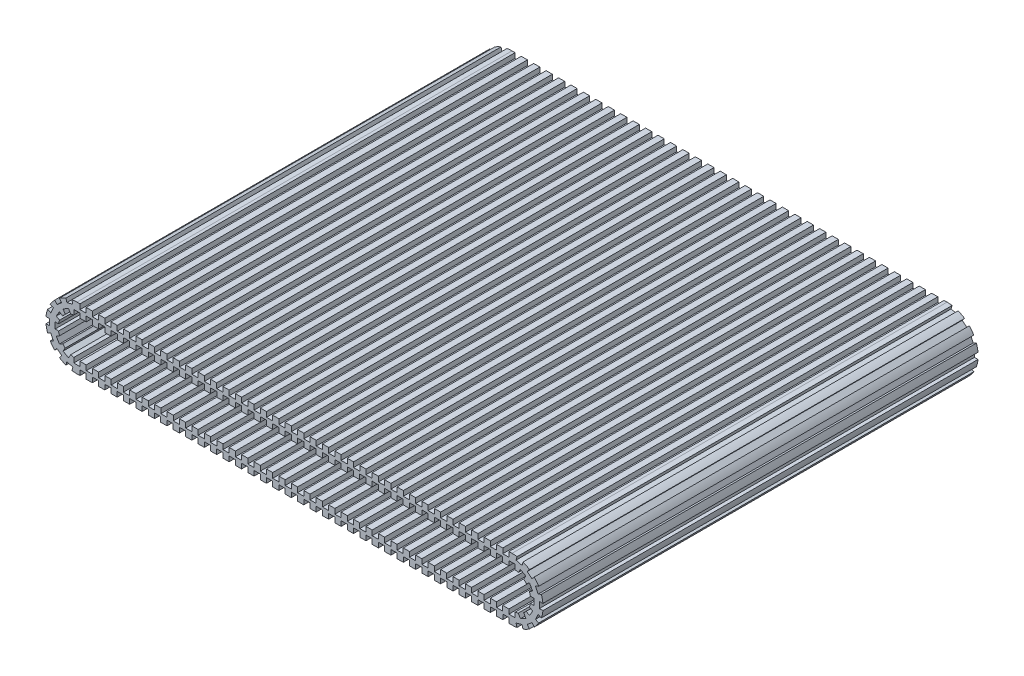
from build123d import *

# Parameters (mm, degrees)
EXTRUDE_1_DEPTH     = 350
SKETCH_2_W          = 5
SKETCH_2_H          = 4
CUT_EXTRUDE_1_DEPTH = 350
SKETCH_3_W          = 5
SKETCH_3_H          = 5
SKETCH_3_W_2        = 6
CUT_EXTRUDE_2_DEPTH = 870


with BuildPart() as part:
    # 草图1 → 凸台-拉伸1 (new body)
    with BuildSketch(Plane.XY):
        with BuildLine():
            Line((-175, 25), (175, 25))
            ThreePointArc((175, 25), (200, 0), (175, -25))
            Line((175, -25), (-175, -25))
            ThreePointArc((-175, -25), (-200, 0), (-175, 25))
        make_face()
        with BuildLine():
            Line((-175, 15), (175, 15))
            ThreePointArc((175, 15), (190, 0), (175, -15))
            Line((175, -15), (-175, -15))
            ThreePointArc((-175, -15), (-190, 0), (-175, 15))
        make_face(mode=Mode.SUBTRACT)
    extrude(amount=EXTRUDE_1_DEPTH)

    # 草图2 → 切除-拉伸1 (cut)
    with BuildSketch(Plane.XY.offset(350)):
        with Locations((0, 23)):
            Rectangle(SKETCH_2_W, SKETCH_2_H)
        with Locations((-10.006494793, 23)):
            Rectangle(SKETCH_2_W, SKETCH_2_H)
        with Locations((-20.012989587, 23)):
            Rectangle(SKETCH_2_W, SKETCH_2_H)
        with Locations((-30.01948438, 23)):
            Rectangle(SKETCH_2_W, SKETCH_2_H)
        with Locations((-40.025979174, 23)):
            Rectangle(SKETCH_2_W, SKETCH_2_H)
        with Locations((-50.032473967, 23)):
            Rectangle(SKETCH_2_W, SKETCH_2_H)
        with Locations((-60.03896876, 23)):
            Rectangle(SKETCH_2_W, SKETCH_2_H)
        with Locations((-70.045463554, 23)):
            Rectangle(SKETCH_2_W, SKETCH_2_H)
        with Locations((-80.051958347, 23)):
            Rectangle(SKETCH_2_W, SKETCH_2_H)
        with Locations((-90.058453141, 23)):
            Rectangle(SKETCH_2_W, SKETCH_2_H)
        with Locations((-100.064947934, 23)):
            Rectangle(SKETCH_2_W, SKETCH_2_H)
        with Locations((100.064947934, 23)):
            Rectangle(SKETCH_2_W, SKETCH_2_H)
        with Locations((90.058453141, 23)):
            Rectangle(SKETCH_2_W, SKETCH_2_H)
        with Locations((80.051958347, 23)):
            Rectangle(SKETCH_2_W, SKETCH_2_H)
        with Locations((70.045463554, 23)):
            Rectangle(SKETCH_2_W, SKETCH_2_H)
        with Locations((60.03896876, 23)):
            Rectangle(SKETCH_2_W, SKETCH_2_H)
        with Locations((50.032473967, 23)):
            Rectangle(SKETCH_2_W, SKETCH_2_H)
        with Locations((40.025979174, 23)):
            Rectangle(SKETCH_2_W, SKETCH_2_H)
        with Locations((30.01948438, 23)):
            Rectangle(SKETCH_2_W, SKETCH_2_H)
        with Locations((20.012989587, 23)):
            Rectangle(SKETCH_2_W, SKETCH_2_H)
        with Locations((10.006494793, 23)):
            Rectangle(SKETCH_2_W, SKETCH_2_H)
        with Locations((-5.006494793, 17)):
            Rectangle(SKETCH_2_W, SKETCH_2_H)
        with Locations((-15.006494793, 17)):
            Rectangle(SKETCH_2_W, SKETCH_2_H)
        with Locations((-25.006494793, 17)):
            Rectangle(SKETCH_2_W, SKETCH_2_H)
        with Locations((-35.006494793, 17)):
            Rectangle(SKETCH_2_W, SKETCH_2_H)
        with Locations((-45.006494793, 17)):
            Rectangle(SKETCH_2_W, SKETCH_2_H)
        with Locations((-55.006494793, 17)):
            Rectangle(SKETCH_2_W, SKETCH_2_H)
        with Locations((-65.006494793, 17)):
            Rectangle(SKETCH_2_W, SKETCH_2_H)
        with Locations((-75.006494793, 17)):
            Rectangle(SKETCH_2_W, SKETCH_2_H)
        with Locations((-85.006494793, 17)):
            Rectangle(SKETCH_2_W, SKETCH_2_H)
        with Locations((-95.006494793, 17)):
            Rectangle(SKETCH_2_W, SKETCH_2_H)
        with Locations((95.006494793, 17)):
            Rectangle(SKETCH_2_W, SKETCH_2_H)
        with Locations((85.006494793, 17)):
            Rectangle(SKETCH_2_W, SKETCH_2_H)
        with Locations((75.006494793, 17)):
            Rectangle(SKETCH_2_W, SKETCH_2_H)
        with Locations((65.006494793, 17)):
            Rectangle(SKETCH_2_W, SKETCH_2_H)
        with Locations((55.006494793, 17)):
            Rectangle(SKETCH_2_W, SKETCH_2_H)
        with Locations((45.006494793, 17)):
            Rectangle(SKETCH_2_W, SKETCH_2_H)
        with Locations((35.006494793, 17)):
            Rectangle(SKETCH_2_W, SKETCH_2_H)
        with Locations((25.006494793, 17)):
            Rectangle(SKETCH_2_W, SKETCH_2_H)
        with Locations((15.006494793, 17)):
            Rectangle(SKETCH_2_W, SKETCH_2_H)
        with Locations((5.006494793, 17)):
            Rectangle(SKETCH_2_W, SKETCH_2_H)
        with Locations((5.006494793, -17)):
            Rectangle(SKETCH_2_W, SKETCH_2_H)
        with Locations((15.006494793, -17)):
            Rectangle(SKETCH_2_W, SKETCH_2_H)
        with Locations((25.006494793, -17)):
            Rectangle(SKETCH_2_W, SKETCH_2_H)
        with Locations((35.006494793, -17)):
            Rectangle(SKETCH_2_W, SKETCH_2_H)
        with Locations((45.006494793, -17)):
            Rectangle(SKETCH_2_W, SKETCH_2_H)
        with Locations((55.006494793, -17)):
            Rectangle(SKETCH_2_W, SKETCH_2_H)
        with Locations((65.006494793, -17)):
            Rectangle(SKETCH_2_W, SKETCH_2_H)
        with Locations((75.006494793, -17)):
            Rectangle(SKETCH_2_W, SKETCH_2_H)
        with Locations((85.006494793, -17)):
            Rectangle(SKETCH_2_W, SKETCH_2_H)
        with Locations((95.006494793, -17)):
            Rectangle(SKETCH_2_W, SKETCH_2_H)
        with Locations((-95.006494793, -17)):
            Rectangle(SKETCH_2_W, SKETCH_2_H)
        with Locations((-85.006494793, -17)):
            Rectangle(SKETCH_2_W, SKETCH_2_H)
        with Locations((-75.006494793, -17)):
            Rectangle(SKETCH_2_W, SKETCH_2_H)
        with Locations((-65.006494793, -17)):
            Rectangle(SKETCH_2_W, SKETCH_2_H)
        with Locations((-55.006494793, -17)):
            Rectangle(SKETCH_2_W, SKETCH_2_H)
        with Locations((-45.006494793, -17)):
            Rectangle(SKETCH_2_W, SKETCH_2_H)
        with Locations((-35.006494793, -17)):
            Rectangle(SKETCH_2_W, SKETCH_2_H)
        with Locations((-25.006494793, -17)):
            Rectangle(SKETCH_2_W, SKETCH_2_H)
        with Locations((-15.006494793, -17)):
            Rectangle(SKETCH_2_W, SKETCH_2_H)
        with Locations((-5.006494793, -17)):
            Rectangle(SKETCH_2_W, SKETCH_2_H)
        with Locations((10.006494793, -23)):
            Rectangle(SKETCH_2_W, SKETCH_2_H)
        with Locations((20.012989587, -23)):
            Rectangle(SKETCH_2_W, SKETCH_2_H)
        with Locations((30.01948438, -23)):
            Rectangle(SKETCH_2_W, SKETCH_2_H)
        with Locations((40.025979174, -23)):
            Rectangle(SKETCH_2_W, SKETCH_2_H)
        with Locations((50.032473967, -23)):
            Rectangle(SKETCH_2_W, SKETCH_2_H)
        with Locations((60.03896876, -23)):
            Rectangle(SKETCH_2_W, SKETCH_2_H)
        with Locations((70.045463554, -23)):
            Rectangle(SKETCH_2_W, SKETCH_2_H)
        with Locations((80.051958347, -23)):
            Rectangle(SKETCH_2_W, SKETCH_2_H)
        with Locations((90.058453141, -23)):
            Rectangle(SKETCH_2_W, SKETCH_2_H)
        with Locations((100.064947934, -23)):
            Rectangle(SKETCH_2_W, SKETCH_2_H)
        with Locations((-100.064947934, -23)):
            Rectangle(SKETCH_2_W, SKETCH_2_H)
        with Locations((-90.058453141, -23)):
            Rectangle(SKETCH_2_W, SKETCH_2_H)
        with Locations((-80.051958347, -23)):
            Rectangle(SKETCH_2_W, SKETCH_2_H)
        with Locations((-70.045463554, -23)):
            Rectangle(SKETCH_2_W, SKETCH_2_H)
        with Locations((-60.03896876, -23)):
            Rectangle(SKETCH_2_W, SKETCH_2_H)
        with Locations((-50.032473967, -23)):
            Rectangle(SKETCH_2_W, SKETCH_2_H)
        with Locations((-40.025979174, -23)):
            Rectangle(SKETCH_2_W, SKETCH_2_H)
        with Locations((-30.01948438, -23)):
            Rectangle(SKETCH_2_W, SKETCH_2_H)
        with Locations((-20.012989587, -23)):
            Rectangle(SKETCH_2_W, SKETCH_2_H)
        with Locations((-10.006494793, -23)):
            Rectangle(SKETCH_2_W, SKETCH_2_H)
        with Locations((0, -23)):
            Rectangle(SKETCH_2_W, SKETCH_2_H)
        with Locations((-110.064947934, 23)):
            Rectangle(SKETCH_2_W, SKETCH_2_H)
        with Locations((-105.006494793, 17)):
            Rectangle(SKETCH_2_W, SKETCH_2_H)
        with Locations((-120.064947934, 23)):
            Rectangle(SKETCH_2_W, SKETCH_2_H)
        with Locations((-115.006494793, 17)):
            Rectangle(SKETCH_2_W, SKETCH_2_H)
        with Locations((-130.064947934, 23)):
            Rectangle(SKETCH_2_W, SKETCH_2_H)
        with Locations((-125.006494793, 17)):
            Rectangle(SKETCH_2_W, SKETCH_2_H)
        with Locations((-140.064947934, 23)):
            Rectangle(SKETCH_2_W, SKETCH_2_H)
        with Locations((-135.006494793, 17)):
            Rectangle(SKETCH_2_W, SKETCH_2_H)
        with Locations((-150.064947934, 23)):
            Rectangle(SKETCH_2_W, SKETCH_2_H)
        with Locations((-145.006494793, 17)):
            Rectangle(SKETCH_2_W, SKETCH_2_H)
        with Locations((-160.064947934, 23)):
            Rectangle(SKETCH_2_W, SKETCH_2_H)
        with Locations((-155.006494793, 17)):
            Rectangle(SKETCH_2_W, SKETCH_2_H)
        with Locations((-170.064947934, 23)):
            Rectangle(SKETCH_2_W, SKETCH_2_H)
        with Locations((-165.006494793, 17)):
            Rectangle(SKETCH_2_W, SKETCH_2_H)
        with Locations((110.064947934, 23)):
            Rectangle(SKETCH_2_W, SKETCH_2_H)
        with Locations((105.006494793, 17)):
            Rectangle(SKETCH_2_W, SKETCH_2_H)
        with Locations((120.064947934, 23)):
            Rectangle(SKETCH_2_W, SKETCH_2_H)
        with Locations((115.006494793, 17)):
            Rectangle(SKETCH_2_W, SKETCH_2_H)
        with Locations((130.064947934, 23)):
            Rectangle(SKETCH_2_W, SKETCH_2_H)
        with Locations((125.006494793, 17)):
            Rectangle(SKETCH_2_W, SKETCH_2_H)
        with Locations((140.064947934, 23)):
            Rectangle(SKETCH_2_W, SKETCH_2_H)
        with Locations((135.006494793, 17)):
            Rectangle(SKETCH_2_W, SKETCH_2_H)
        with Locations((150.064947934, 23)):
            Rectangle(SKETCH_2_W, SKETCH_2_H)
        with Locations((145.006494793, 17)):
            Rectangle(SKETCH_2_W, SKETCH_2_H)
        with Locations((160.064947934, 23)):
            Rectangle(SKETCH_2_W, SKETCH_2_H)
        with Locations((155.006494793, 17)):
            Rectangle(SKETCH_2_W, SKETCH_2_H)
        with Locations((170.064947934, 23)):
            Rectangle(SKETCH_2_W, SKETCH_2_H)
        with Locations((165.006494793, 17)):
            Rectangle(SKETCH_2_W, SKETCH_2_H)
        with Locations((110.064947934, -23)):
            Rectangle(SKETCH_2_W, SKETCH_2_H)
        with Locations((105.006494793, -17)):
            Rectangle(SKETCH_2_W, SKETCH_2_H)
        with Locations((120.064947934, -23)):
            Rectangle(SKETCH_2_W, SKETCH_2_H)
        with Locations((115.006494793, -17)):
            Rectangle(SKETCH_2_W, SKETCH_2_H)
        with Locations((130.064947934, -23)):
            Rectangle(SKETCH_2_W, SKETCH_2_H)
        with Locations((125.006494793, -17)):
            Rectangle(SKETCH_2_W, SKETCH_2_H)
        with Locations((140.064947934, -23)):
            Rectangle(SKETCH_2_W, SKETCH_2_H)
        with Locations((135.006494793, -17)):
            Rectangle(SKETCH_2_W, SKETCH_2_H)
        with Locations((150.064947934, -23)):
            Rectangle(SKETCH_2_W, SKETCH_2_H)
        with Locations((145.006494793, -17)):
            Rectangle(SKETCH_2_W, SKETCH_2_H)
        with Locations((160.064947934, -23)):
            Rectangle(SKETCH_2_W, SKETCH_2_H)
        with Locations((155.006494793, -17)):
            Rectangle(SKETCH_2_W, SKETCH_2_H)
        with Locations((170.064947934, -23)):
            Rectangle(SKETCH_2_W, SKETCH_2_H)
        with Locations((165.006494793, -17)):
            Rectangle(SKETCH_2_W, SKETCH_2_H)
        with Locations((-110.064947934, -23)):
            Rectangle(SKETCH_2_W, SKETCH_2_H)
        with Locations((-105.006494793, -17)):
            Rectangle(SKETCH_2_W, SKETCH_2_H)
        with Locations((-120.064947934, -23)):
            Rectangle(SKETCH_2_W, SKETCH_2_H)
        with Locations((-115.006494793, -17)):
            Rectangle(SKETCH_2_W, SKETCH_2_H)
        with Locations((-130.064947934, -23)):
            Rectangle(SKETCH_2_W, SKETCH_2_H)
        with Locations((-125.006494793, -17)):
            Rectangle(SKETCH_2_W, SKETCH_2_H)
        with Locations((-140.064947934, -23)):
            Rectangle(SKETCH_2_W, SKETCH_2_H)
        with Locations((-135.006494793, -17)):
            Rectangle(SKETCH_2_W, SKETCH_2_H)
        with Locations((-150.064947934, -23)):
            Rectangle(SKETCH_2_W, SKETCH_2_H)
        with Locations((-145.006494793, -17)):
            Rectangle(SKETCH_2_W, SKETCH_2_H)
        with Locations((-160.064947934, -23)):
            Rectangle(SKETCH_2_W, SKETCH_2_H)
        with Locations((-155.006494793, -17)):
            Rectangle(SKETCH_2_W, SKETCH_2_H)
        with Locations((-170.064947934, -23)):
            Rectangle(SKETCH_2_W, SKETCH_2_H)
        with Locations((-165.006494793, -17)):
            Rectangle(SKETCH_2_W, SKETCH_2_H)
    extrude(amount=-CUT_EXTRUDE_1_DEPTH, mode=Mode.SUBTRACT)

    # 草图3 → 切除-拉伸2 (cut)
    with BuildSketch(Plane(origin=(0, 0, 0), x_dir=(-1, 0, 0), z_dir=(0, 0, -1))):
        Polygon((187.28626888, -4.450314917), (184.78626888, -8.780441936), (189.116395899, -11.280441936), (191.616395899, -6.950314917), align=None)
        with Locations((190, 0)):
            Rectangle(SKETCH_3_W, SKETCH_3_H)
        Polygon((183.626014842, -10.36259864), (179.295887823, -12.86259864), (181.795887823, -17.192725659), (186.126014842, -14.692725659), align=None)
        with Locations((175, -16.152659519)):
            Rectangle(SKETCH_3_W, SKETCH_3_H)
        with Locations((175, 16.152659519)):
            Rectangle(SKETCH_3_W, SKETCH_3_H)
        Polygon((183.626014842, 10.36259864), (186.126014842, 14.692725659), (181.795887823, 17.192725659), (179.295887823, 12.86259864), align=None)
        Polygon((187.28626888, 4.450314917), (191.616395899, 6.950314917), (189.116395899, 11.280441936), (184.78626888, 8.780441936), align=None)
        Polygon((195.995316969, -7.031832291), (193.88222566, -11.563371226), (199.320072383, -14.099080796), (201.433163691, -9.567541861), align=None)
        with Locations((200, 0)):
            Rectangle(SKETCH_3_W_2, SKETCH_3_H)
        Polygon((191.056438521, -15.246008724), (187.226216305, -18.459946773), (191.082941963, -23.056213432), (194.913164179, -19.842275383), align=None)
        Polygon((183.108833558, -20.603320566), (178.279204427, -21.897415791), (179.832118697, -27.692970749), (184.661747829, -26.398875523), align=None)
        Polygon((183.108833558, 20.603320566), (184.661747829, 26.398875523), (179.832118697, 27.692970749), (178.279204427, 21.897415791), align=None)
        Polygon((191.056438521, 15.246008724), (194.913164179, 19.842275383), (191.082941963, 23.056213432), (187.226216305, 18.459946773), align=None)
        Polygon((195.995316969, 7.031832291), (201.433163691, 9.567541861), (199.320072383, 14.099080796), (193.88222566, 11.563371226), align=None)
        Polygon((-195.995316969, 7.031832291), (-193.88222566, 11.563371226), (-199.320072383, 14.099080796), (-201.433163691, 9.567541861), align=None)
        Polygon((-191.056438521, 15.246008724), (-187.226216305, 18.459946773), (-191.082941963, 23.056213432), (-194.913164179, 19.842275383), align=None)
        Polygon((-183.108833558, 20.603320566), (-178.279204427, 21.897415791), (-179.832118697, 27.692970749), (-184.661747829, 26.398875523), align=None)
        Polygon((-178.279204427, -21.897415791), (-179.832118697, -27.692970749), (-184.661747829, -26.398875523), (-183.108833558, -20.603320566), align=None)
        Polygon((-187.226216305, -18.459946773), (-191.082941963, -23.056213432), (-194.913164179, -19.842275383), (-191.056438521, -15.246008724), align=None)
        Polygon((-193.88222566, -11.563371226), (-199.320072383, -14.099080796), (-201.433163691, -9.567541861), (-195.995316969, -7.031832291), align=None)
        with Locations((-200, 0)):
            Rectangle(SKETCH_3_W_2, SKETCH_3_H)
        Polygon((-187.28626888, 4.450314917), (-184.78626888, 8.780441936), (-189.116395899, 11.280441936), (-191.616395899, 6.950314917), align=None)
        Polygon((-183.626014842, 10.36259864), (-179.295887823, 12.86259864), (-181.795887823, 17.192725659), (-186.126014842, 14.692725659), align=None)
        with Locations((-175, 16.152659519)):
            Rectangle(SKETCH_3_W, SKETCH_3_H)
        with Locations((-175, -16.152659519)):
            Rectangle(SKETCH_3_W, SKETCH_3_H)
        Polygon((-179.295887823, -12.86259864), (-181.795887823, -17.192725659), (-186.126014842, -14.692725659), (-183.626014842, -10.36259864), align=None)
        Polygon((-184.78626888, -8.780441936), (-189.116395899, -11.280441936), (-191.616395899, -6.950314917), (-187.28626888, -4.450314917), align=None)
        with Locations((-190, 0)):
            Rectangle(SKETCH_3_W, SKETCH_3_H)
    extrude(amount=-CUT_EXTRUDE_2_DEPTH, mode=Mode.SUBTRACT)


solid = part.part
